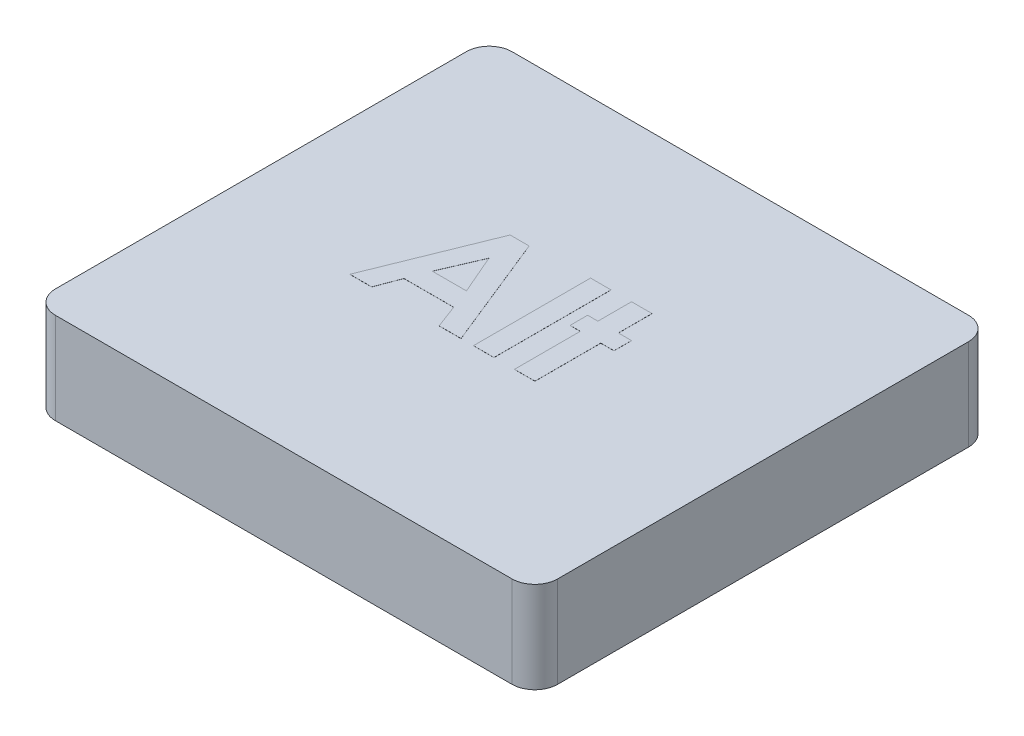
from build123d import *

# Parameters (mm, degrees)
SKETCH1_W           = 13.97
SKETCH1_H           = 12.7
BOSS_EXTRUDE1_DEPTH = 2.54
FILLET1_R           = 0.635
SHELL1_START        = 0.635
SHELL1_OUTLINE_W    = 1.905
SHELL1_OUTLINE_H    = 11.43
SHELL1_DEPTH        = 12.7
SKETCH2_R           = 2.54
BOSS_EXTRUDE2_DEPTH = 1.905
SKETCH3_W           = 0.569871795
SKETCH3_H           = 3.256410256
BOSS_EXTRUDE3_DEPTH = 0.00254


# Read off the part's stored shape, not the designer's step: Shell1
with BuildPart() as part:
    # Sketch1 → Boss-Extrude1 (new body)
    with BuildSketch(Plane(origin=(0, 0, 0), x_dir=(1, 0, 0), z_dir=(0, 1, 0))):
        with Locations((6.985, 6.35)):
            Rectangle(SKETCH1_W, SKETCH1_H)
    extrude(amount=BOSS_EXTRUDE1_DEPTH)

    # Fillet1
    fillet1_edges = [part.edges().sort_by_distance(p)[0] for p in [
        (0, 1.27, -12.7),
        (13.97, 1.27, -12.7),
        (13.97, 1.27, 0),
        (0, 1.27, 0),
    ]]
    fillet(fillet1_edges, radius=FILLET1_R)

    # Shell1 outline → Shell1 (cut)
    with BuildSketch(Plane.YZ.offset(SHELL1_START)):
        with Locations((0.9525, -6.35)):
            Rectangle(SHELL1_OUTLINE_W, SHELL1_OUTLINE_H)
    extrude(amount=SHELL1_DEPTH, mode=Mode.SUBTRACT)

    # Sketch2 → Boss-Extrude2 (add)
    with BuildSketch(Plane(origin=(0, 1.905, 0), x_dir=(-1, 0, 0), z_dir=(0, -1, 0))):
        with Locations(Location((-6.985, 6.35, 0), (0, 0, 270))):
            Circle(SKETCH2_R)
    extrude(amount=BOSS_EXTRUDE2_DEPTH)

    # Sketch3 → Boss-Extrude3 (add)
    # profile 1 of 3: a face of its own
    with BuildSketch(Plane(origin=(0, 2.54, 0), x_dir=(1, 0, 0), z_dir=(0, 1, 0))):
        Polygon((5.026905248, 8.255), (5.555435897, 8.255), (6.837647436, 5.08), (6.228978566, 5.08), (5.982203726, 5.731282051), (4.598865385, 5.731282051), (4.352090545, 5.08), (3.744057692, 5.08), align=None)
        Polygon((5.290852564, 7.403372396), (4.815111378, 6.301153846), (5.76659375, 6.301153846), align=None, mode=Mode.SUBTRACT)
    # profile 2 of 3: a face of its own
    with BuildSketch(Plane(origin=(0, 2.54, 0), x_dir=(1, 0, 0), z_dir=(0, 1, 0))):
        with Locations((7.468576924, 6.708205128)):
            Rectangle(SKETCH3_W, SKETCH3_H)
    # profile 3 of 3: a face of its own
    with BuildSketch(Plane(origin=(0, 2.54, 0), x_dir=(1, 0, 0), z_dir=(0, 1, 0))):
        Polygon((8.323384615, 8.336410256), (8.89325641, 8.336410256), (8.89325641, 7.400192308), (9.259602564, 7.400192308), (9.259602564, 6.911730769), (8.89325641, 6.911730769), (8.89325641, 5.08), (8.323384615, 5.08), (8.323384615, 6.911730769), (8.038448718, 6.911730769), (8.038448718, 7.400192308), (8.323384615, 7.400192308), align=None)
    extrude(amount=BOSS_EXTRUDE3_DEPTH)


solid = part.part
